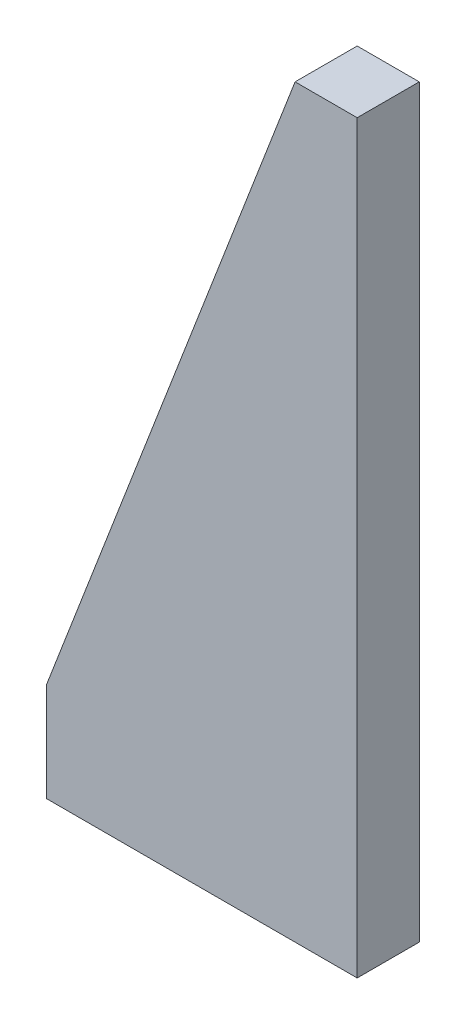
from build123d import *

# Parameters (mm, degrees)
EXTRUDE_1_DEPTH = 12.5


with BuildPart() as part:
    # Эскиз1 → Бобышка-Вытянуть1 (new, symmetric)
    with BuildSketch(Plane.XY):
        Polygon((0, 300), (-25, 300), (-125, 40), (-125, 0), (0, 0), align=None)
    extrude(amount=EXTRUDE_1_DEPTH, both=True)


solid = part.part
